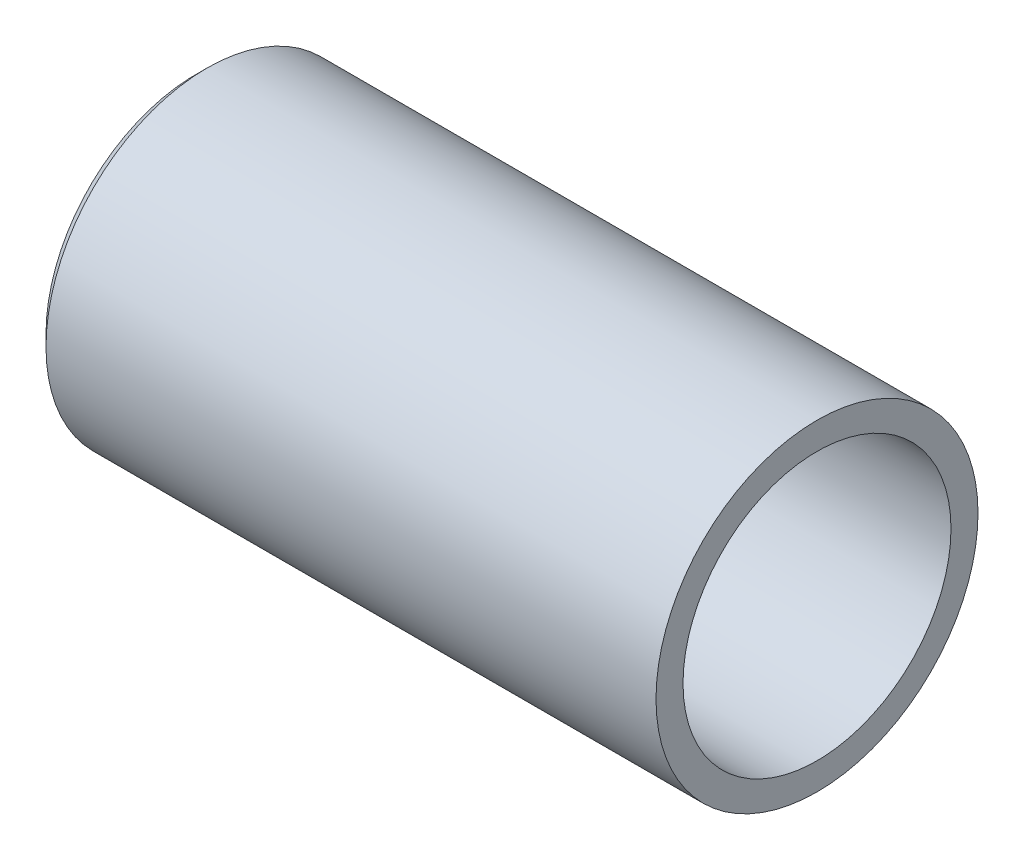
from build123d import *


with BuildPart() as part:
    # Sketch1 → Revolve1 (revolve)
    with BuildSketch(Plane.XY):
        Polygon((6.537620818, 4.768749924), (24.60625, 4.768749924), (24.60625, 3.96875), (6.20625, 3.96875), (6.20625, 4.437379106), align=None)
    revolve(axis=Axis((0, 0, 0), (1, 0, 0)))


solid = part.part
